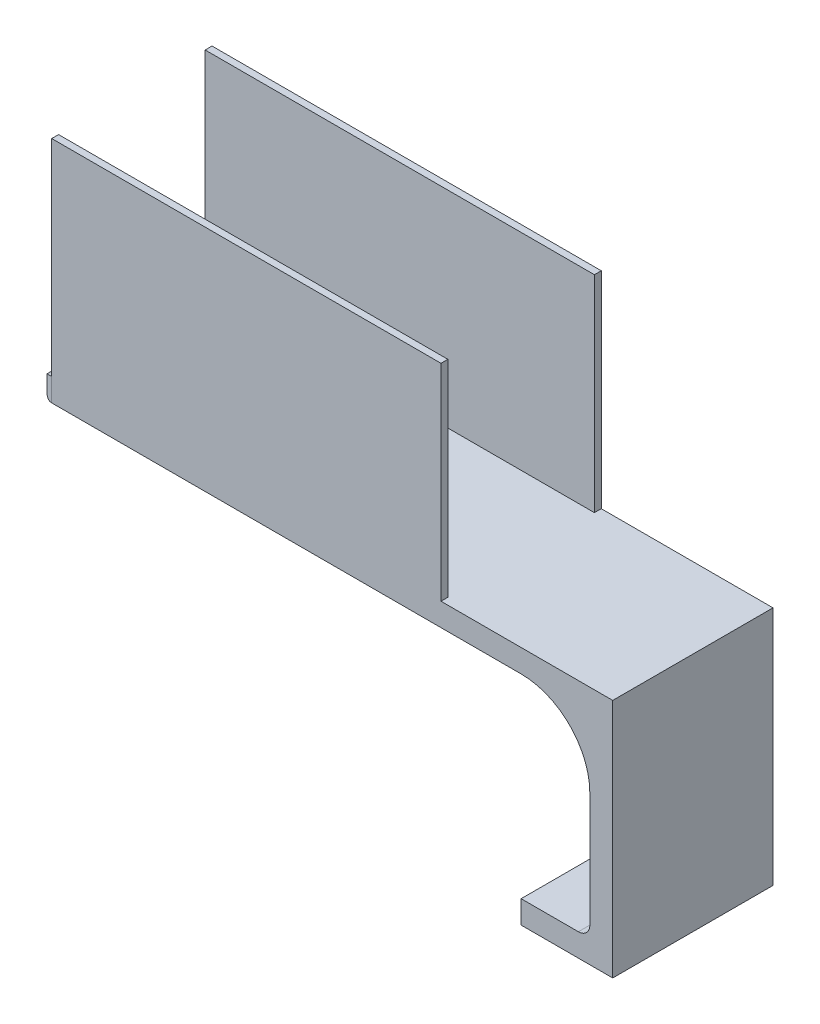
from build123d import *

# Parameters (mm, degrees)
BOSS_EXTRUDE1_DEPTH = 14
FILLET1_R           = 1
SKETCH2_W           = 0.834188385
SKETCH2_H           = 3
BOSS_EXTRUDE2_DEPTH = 0.8
SKETCH4_W           = 34
SKETCH4_H           = 0.6
BOSS_EXTRUDE3_DEPTH = 18
FILLET2_R           = 6


with BuildPart() as part:
    # Sketch1 → Boss-Extrude1 (new body)
    with BuildSketch(Plane.XY):
        Polygon((0, 0), (8, 0), (8, 21), (-42, 21), (-42, 19), (6, 19), (6, 2), (0, 2), align=None)
    extrude(amount=BOSS_EXTRUDE1_DEPTH)

    # Fillet1
    fillet1_edges = [part.edges().sort_by_distance(p)[0] for p in [
        (6, 2, 7),
        (-42, 19, 7),
        (-42, 21, 7),
        (-42, 20, 14),
        (-42, 20, 0),
    ]]
    fillet(fillet1_edges, radius=FILLET1_R - 0.0001)  # a hair under: the kernel refuses the full size

    # Sketch2 → Boss-Extrude2 (add)
    # profile 1 of 4: a face of its own
    with BuildSketch(Plane.ZY.offset(-6)):
        Polygon((4.939361172, 9.711644626), (4.939361172, 6.711644626), (4.105172787, 6.711644626), (4.105172787, 8.367093015), (3.539402215, 6.711644626), (2.841269648, 6.711644626), (2.271189615, 8.380021396), (2.271189615, 6.711644626), (1.43700123, 6.711644626), (1.43700123, 9.711644626), (2.445414938, 9.711644626), (3.198954852, 7.7625373), (3.934641287, 9.711644626), align=None)
    # profile 2 of 4: a face of its own
    with BuildSketch(Plane.ZY.offset(-6)):
        with Locations((5.833574182, 8.211644626)):
            Rectangle(SKETCH2_W, SKETCH2_H)
    # profile 3 of 4: a face of its own
    with BuildSketch(Plane.ZY.offset(-6)):
        with BuildLine():
            add(Edge.make_bspline(
                [(6.614509951, 8.218108816), (6.615135106, 8.254448488), (6.616373041, 8.326408498), (6.625189655, 8.432667458), (6.639209425, 8.536107559), (6.65939093, 8.636515812), (6.686243594, 8.733758084), (6.717322014, 8.828389932), (6.754995658, 8.919737366), (6.798850566, 9.007520954), (6.847178581, 9.091868165), (6.900855585, 9.171515602), (6.959668219, 9.246253038), (7.022837086, 9.316374569), (7.091146849, 9.381636211), (7.164565924, 9.44160163), (7.241976851, 9.498129553), (7.324872646, 9.548317457), (7.411265804, 9.593927372), (7.501416301, 9.633324168), (7.594752677, 9.66684746), (7.691397658, 9.693440882), (7.790923553, 9.715666032), (7.893905489, 9.729729553), (7.999914274, 9.739548614), (8.071699663, 9.740641742), (8.108045761, 9.741195211)],
                knots=[0, 0, 0, 0, 1.090921121, 2.160247797, 3.198836581, 4.223443441, 5.232277131, 6.225889638, 7.212121003, 8.195751059, 9.170075774, 10.128690879, 11.076474727, 12.023036313, 12.959924458, 13.90968863, 14.86725387, 15.835129268, 16.816189809, 17.798313747, 18.786313932, 19.790849238, 20.805928127, 21.845375407, 22.909078879, 24, 24, 24, 24], degree=3))
            add(Edge.make_bspline(
                [(8.108045761, 9.741195211), (8.154046355, 9.740184442), (8.244197417, 9.738203559), (8.376777061, 9.724541603), (8.503730488, 9.701545416), (8.624943818, 9.667651172), (8.741125222, 9.626398506), (8.851138025, 9.574118341), (8.955656013, 9.513049603), (9.05395443, 9.442773482), (9.145612872, 9.365118732), (9.228508, 9.279431694), (9.303260403, 9.187344206), (9.37012033, 9.088754614), (9.427487701, 8.982814897), (9.47594731, 8.870173202), (9.517232427, 8.751158904), (9.53683413, 8.668340065), (9.546789861, 8.626276269)],
                knots=[0, 0, 0, 0, 1.113135575, 2.18150124, 3.221796349, 4.231436138, 5.224276571, 6.201745712, 7.174434406, 8.150085186, 9.122368106, 10.077633641, 11.030857373, 11.989524825, 12.956211094, 13.941533538, 14.954502201, 16, 16, 16, 16], degree=3))
            Line((9.546789861, 8.626276269), (8.648575209, 8.626276269))
            add(Edge.make_bspline(
                [(8.648575209, 8.626276269), (8.63449873, 8.653367332), (8.607009, 8.70627303), (8.554750734, 8.777220049), (8.494294025, 8.83772523), (8.426434183, 8.887816356), (8.351706394, 8.926709067), (8.271496202, 8.95555173), (8.185279709, 8.972256045), (8.12597045, 8.974300325), (8.095733017, 8.975342553)],
                knots=[0, 0, 0, 0, 1.056424033, 2.063073462, 3.038256493, 4.009362991, 4.972841785, 5.946442968, 6.953042193, 8, 8, 8, 8], degree=3))
            add(Edge.make_bspline(
                [(8.095733017, 8.975342553), (8.072090982, 8.974857598), (8.026024844, 8.97391267), (7.958855252, 8.963438039), (7.895261592, 8.947998962), (7.835572703, 8.924638392), (7.779314442, 8.895753525), (7.726494212, 8.860395837), (7.677529764, 8.81819401), (7.633115793, 8.769428074), (7.591926635, 8.716234798), (7.558150732, 8.656990307), (7.527166037, 8.594975235), (7.503597705, 8.527604122), (7.484151008, 8.456511723), (7.471975244, 8.380528821), (7.462567968, 8.300837982), (7.461944601, 8.246048478), (7.461626717, 8.218108816)],
                knots=[0, 0, 0, 0, 1.019109895, 1.985719724, 2.926230684, 3.837105113, 4.743882796, 5.649968679, 6.572811938, 7.525125039, 8.491937575, 9.468270023, 10.462147427, 11.478754545, 12.541796802, 13.637803784, 14.795408623, 16, 16, 16, 16], degree=3))
            add(Edge.make_bspline(
                [(7.461626717, 8.218108816), (7.461932197, 8.189757505), (7.462529191, 8.1343511), (7.472061881, 8.053655274), (7.483974306, 7.977004795), (7.50371514, 7.905366671), (7.527170681, 7.837570259), (7.557994097, 7.77504496), (7.59194367, 7.715682222), (7.633111318, 7.662477774), (7.677530915, 7.61371476), (7.726493913, 7.571512181), (7.779314521, 7.536154688), (7.835572682, 7.507269769), (7.895261598, 7.483909213), (7.95885525, 7.468470132), (8.026024845, 7.457995502), (8.072090982, 7.457050574), (8.095733017, 7.456565619)],
                knots=[0, 0, 0, 0, 1.217704484, 2.379735683, 3.489019084, 4.548072599, 5.569165517, 6.567256767, 7.539925826, 8.503110694, 9.45185053, 10.371231102, 11.273917174, 12.177292452, 13.084749103, 14.021731083, 14.984714004, 16, 16, 16, 16], degree=3))
            add(Edge.make_bspline(
                [(8.095733017, 7.456565619), (8.125970495, 7.457607814), (8.185279842, 7.459652029), (8.271495701, 7.47635681), (8.351708196, 7.505197779), (8.426427502, 7.544096733), (8.494319234, 7.594164388), (8.554538191, 7.65464137), (8.607198031, 7.725083108), (8.634537031, 7.777897067), (8.648575209, 7.805016265)],
                knots=[0, 0, 0, 0, 1.047706149, 2.055024869, 3.02932196, 3.993489428, 4.965290051, 5.941170122, 6.942820858, 8, 8, 8, 8], degree=3))
            Line((8.648575209, 7.805016265), (9.546789861, 7.805016265))
            add(Edge.make_bspline(
                [(9.546789861, 7.805016265), (9.536858558, 7.762944138), (9.517349574, 7.680297939), (9.475808754, 7.561577975), (9.427505884, 7.449085635), (9.370107773, 7.343163076), (9.303292421, 7.244533723), (9.228299705, 7.152473009), (9.145837053, 7.066161648), (9.05392426, 6.988548174), (8.95566408, 6.918235146), (8.851135856, 6.857176288), (8.741125814, 6.804893457), (8.624943656, 6.76364152), (8.503730533, 6.729747075), (8.376777049, 6.706750944), (8.244197421, 6.693088973), (8.154046357, 6.691108091), (8.108045761, 6.690097324)],
                knots=[0, 0, 0, 0, 1.045571553, 2.053913598, 3.03930555, 4.006060013, 4.964795093, 5.918086069, 6.876988367, 7.849339876, 8.825059482, 9.797816793, 10.775354888, 11.76826536, 12.777976374, 13.818344869, 14.886785901, 16, 16, 16, 16], degree=3))
            add(Edge.make_bspline(
                [(8.108045761, 6.690097324), (8.071699626, 6.690650706), (7.999914166, 6.691743663), (7.893905905, 6.701563975), (7.790922048, 6.715622905), (7.691403112, 6.737864687), (7.594732679, 6.764397286), (7.501566436, 6.798115207), (7.411144585, 6.836651007), (7.324671539, 6.882258127), (7.242359489, 6.933327019), (7.164371021, 6.988993648), (7.090960402, 7.049064526), (7.023038193, 7.114919345), (6.959641238, 7.185011465), (6.900857249, 7.259781776), (6.847199661, 7.339433565), (6.798670926, 7.423888516), (6.755171797, 7.51205103), (6.7171746, 7.603669167), (6.686256305, 7.698778694), (6.659482893, 7.796440293), (6.63907019, 7.897421714), (6.625255023, 8.001509578), (6.616343023, 8.108781473), (6.615126146, 8.181358007), (6.614509951, 8.218108816)],
                knots=[0, 0, 0, 0, 1.088679172, 2.15019663, 3.187507745, 4.200500548, 5.202971437, 6.188941185, 7.166594588, 8.145638954, 9.114748649, 10.066759289, 11.014571603, 11.953790118, 12.898406428, 13.844242488, 14.800887546, 15.773209929, 16.760329183, 17.744533747, 18.741938946, 19.754633173, 20.777134367, 21.825771658, 22.899029122, 24, 24, 24, 24], degree=3))
        make_face()
    # profile 4 of 4: a face of its own
    with BuildSketch(Plane.ZY.offset(-6)):
        with BuildLine():
            add(Edge.make_bspline(
                [(11.385698131, 6.682094041), (11.350995943, 6.682674034), (11.282083675, 6.683825796), (11.179700309, 6.693412364), (11.079513162, 6.708516905), (10.981508096, 6.730462683), (10.885446339, 6.757730972), (10.791805014, 6.792809297), (10.699855187, 6.832514921), (10.610734436, 6.878847944), (10.524835579, 6.930203143), (10.443273911, 6.986870679), (10.366944363, 7.049047687), (10.293731103, 7.114577606), (10.226287319, 7.186220598), (10.163361039, 7.26224072), (10.104416959, 7.342609083), (10.050654037, 7.427825762), (10.001855232, 7.516851414), (9.96004412, 7.609316692), (9.924837224, 7.704620731), (9.89592124, 7.802738167), (9.872982895, 7.903665242), (9.857278801, 8.007584869), (9.846929643, 8.114060638), (9.845895752, 8.186071057), (9.845373896, 8.222418276)],
                knots=[0, 0, 0, 0, 1.027457631, 2.040345022, 3.042474354, 4.025911674, 5.012573142, 5.996967561, 6.984844717, 7.976899908, 8.969066769, 9.94683625, 10.914888525, 11.882883577, 12.854363136, 13.825405439, 14.8038734, 15.80362301, 16.807078105, 17.807916817, 18.805817775, 19.813386312, 20.835058856, 21.868144077, 22.923946896, 24, 24, 24, 24], degree=3))
            add(Edge.make_bspline(
                [(9.845373896, 8.222418276), (9.845895794, 8.258765477), (9.846929769, 8.330775857), (9.857278311, 8.437251906), (9.872984681, 8.541170502), (9.895914687, 8.642101352), (9.92486122, 8.74020496), (9.959890792, 8.835384579), (10.002025802, 8.92749718), (10.050634732, 9.016402607), (10.104413447, 9.101618216), (10.163392991, 9.181948302), (10.22606925, 9.258006029), (10.293983258, 9.32898211), (10.366700726, 9.394650773), (10.443524141, 9.456002268), (10.524613709, 9.512941083), (10.610951714, 9.563362952), (10.699691546, 9.610002481), (10.79182895, 9.648965715), (10.885575157, 9.683229086), (10.981405795, 9.71092277), (11.079607724, 9.731787774), (11.179686369, 9.747177007), (11.282087234, 9.756685395), (11.350997135, 9.757847733), (11.385698131, 9.758433052)],
                knots=[0, 0, 0, 0, 1.077069277, 2.133869147, 3.167929965, 4.190567328, 5.199087364, 6.197930693, 7.194177692, 8.198580403, 9.199274129, 10.178666109, 11.150625418, 12.118617686, 13.087526866, 14.052686502, 15.031379342, 16.02136737, 17.014359411, 18.000753053, 18.983990828, 19.971584052, 20.954652477, 21.957728173, 22.971572087, 24, 24, 24, 24], degree=3))
            add(Edge.make_bspline(
                [(11.385698131, 9.758433052), (11.420809199, 9.757851183), (11.490333357, 9.756699012), (11.593559687, 9.74719891), (11.694426951, 9.731675323), (11.793139794, 9.711214896), (11.889066891, 9.683090775), (11.982640495, 9.648965657), (12.07465287, 9.610144923), (12.162900615, 9.563335797), (12.24866793, 9.512970758), (12.329153966, 9.455790097), (12.405903293, 9.394857511), (12.478016985, 9.328942863), (12.545343487, 9.258000552), (12.607393056, 9.18193355), (12.66575914, 9.101601949), (12.718912194, 9.016383163), (12.766957247, 8.927496157), (12.808322445, 8.83524344), (12.843441304, 8.740210108), (12.872591964, 8.642186587), (12.894510846, 8.541079481), (12.910482751, 8.437264783), (12.920757551, 8.330772536), (12.921801574, 8.258764363), (12.922328544, 8.222418276)],
                knots=[0, 0, 0, 0, 1.041084035, 2.061472223, 3.071041691, 4.066480792, 5.048698968, 6.032405368, 7.019269139, 8.007333064, 8.992563031, 9.966735921, 10.932355565, 11.897227032, 12.861484175, 13.830033399, 14.806313925, 15.804242603, 16.806226752, 17.800437353, 18.799756744, 19.808757456, 20.830560156, 21.865113821, 22.922417377, 24, 24, 24, 24], degree=3))
            add(Edge.make_bspline(
                [(12.922328544, 8.222418276), (12.921801615, 8.186072172), (12.920757675, 8.114063962), (12.91048227, 8.007571983), (12.894512599, 7.903756296), (12.872585536, 7.802652811), (12.843464874, 7.704616011), (12.808170408, 7.609455891), (12.767123517, 7.51685661), (12.718903645, 7.427836136), (12.665716927, 7.342657834), (12.607488708, 7.262031818), (12.544435547, 7.186462746), (12.477689804, 7.114362527), (12.404416989, 7.0490805), (12.328132414, 6.986860392), (12.246555622, 6.930211278), (12.160671953, 6.878825556), (12.071672788, 6.83268263), (11.980068942, 6.792654014), (11.88655261, 6.757767731), (11.790324353, 6.730350255), (11.692262878, 6.708674083), (11.592118593, 6.693340944), (11.48972141, 6.683819628), (11.420604976, 6.682673092), (11.385698131, 6.682094041)],
                knots=[0, 0, 0, 0, 1.076827258, 2.133389664, 3.167218127, 4.188304562, 5.196597983, 6.19521687, 7.194280065, 8.195561842, 9.192790992, 10.168387163, 11.140128072, 12.108132088, 13.076823553, 14.045572283, 15.024045209, 16.016925874, 17.009694788, 17.992711629, 18.977814259, 19.96518557, 20.955268699, 21.952108375, 22.965724476, 24, 24, 24, 24], degree=3))
        make_face()
        with BuildLine():
            add(Edge.make_bspline(
                [(11.385698131, 7.456565619), (11.411585007, 7.457096176), (11.462324673, 7.458136097), (11.536206614, 7.468033666), (11.605835616, 7.484860668), (11.67128956, 7.507567963), (11.732833872, 7.536510362), (11.789898163, 7.572722733), (11.842952094, 7.61507825), (11.890950051, 7.664285102), (11.934838848, 7.718107458), (11.972247564, 7.777408124), (12.003840556, 7.841068523), (12.030449617, 7.908714182), (12.050736829, 7.981124337), (12.064598171, 8.057819871), (12.073428374, 8.138691769), (12.074608064, 8.194075368), (12.075211778, 8.222418276)],
                knots=[0, 0, 0, 0, 1.067089171, 2.09155204, 3.066481157, 4.016560595, 4.943945447, 5.864276661, 6.797319754, 7.73678768, 8.693626662, 9.656136735, 10.621173085, 11.620620688, 12.649338655, 13.716562035, 14.831436133, 16, 16, 16, 16], degree=3))
            add(Edge.make_bspline(
                [(12.075211778, 8.222418276), (12.074605033, 8.251375833), (12.073418892, 8.307985747), (12.064641874, 8.390504101), (12.050785352, 8.468428757), (12.030595052, 8.541509171), (12.003636315, 8.609410128), (11.972614783, 8.673382164), (11.934618508, 8.73234221), (11.890949936, 8.786071629), (11.843147813, 8.835346483), (11.78968563, 8.876972687), (11.732865043, 8.913300654), (11.671269185, 8.942130353), (11.605931614, 8.965095728), (11.536106236, 8.980894732), (11.46233898, 8.991069868), (11.41158984, 8.99207009), (11.385698131, 8.992580394)],
                knots=[0, 0, 0, 0, 1.18883488, 2.324085585, 3.403324648, 4.435760984, 5.430939693, 6.399398042, 7.350695849, 8.303447928, 9.238903148, 10.162711262, 11.079111508, 12.002535262, 12.948556669, 13.917381511, 14.937468638, 16, 16, 16, 16], degree=3))
            add(Edge.make_bspline(
                [(11.385698131, 8.992580394), (11.359392659, 8.99209695), (11.308226521, 8.991156615), (11.233687246, 8.980726107), (11.163363998, 8.965307445), (11.097662036, 8.942118339), (11.036093397, 8.913274082), (10.979287837, 8.87717668), (10.926397903, 8.835103282), (10.878573504, 8.786275101), (10.835513671, 8.732312824), (10.798275602, 8.673196755), (10.767003005, 8.609556154), (10.740811649, 8.541460389), (10.72137548, 8.468338615), (10.707324505, 8.390514569), (10.698605267, 8.307982927), (10.697411015, 8.251374879), (10.696800122, 8.222418276)],
                knots=[0, 0, 0, 0, 1.078588718, 2.097936879, 3.082471155, 4.02780725, 4.950562063, 5.866298455, 6.782847408, 7.71762497, 8.664422376, 9.610508143, 10.578264927, 11.569688157, 12.59914077, 13.677598016, 14.812026329, 16, 16, 16, 16], degree=3))
            add(Edge.make_bspline(
                [(10.696800122, 8.222418276), (10.697400714, 8.193665585), (10.698570392, 8.137668533), (10.707381622, 8.055968006), (10.721350475, 7.978946988), (10.740927848, 7.906282926), (10.766983419, 7.838348802), (10.798309451, 7.774743053), (10.835314684, 7.715649369), (10.878783161, 7.662211949), (10.926398856, 7.613450591), (10.979106269, 7.571261936), (11.0362902, 7.535983946), (11.097634928, 7.506983947), (11.163371662, 7.483850932), (11.233685089, 7.468416427), (11.308227105, 7.457990341), (11.359392858, 7.457049383), (11.385698131, 7.456565619)],
                knots=[0, 0, 0, 0, 1.183449987, 2.30481765, 3.378522997, 4.403220538, 5.397914201, 6.368863349, 7.318069994, 8.261394005, 9.199255143, 10.118827539, 11.033107389, 11.958906117, 12.907360617, 13.895142602, 14.917853314, 16, 16, 16, 16], degree=3))
        make_face(mode=Mode.SUBTRACT)
    extrude(amount=BOSS_EXTRUDE2_DEPTH)

    # Sketch4 → Boss-Extrude3 (add)
    with BuildSketch(Plane(origin=(0, 21, 0), x_dir=(1, 0, 0), z_dir=(0, 1, 0))):
        with Locations((-24, -0.3)):
            Rectangle(SKETCH4_W, SKETCH4_H)
        with Locations((-24, -13.7)):
            Rectangle(SKETCH4_W, SKETCH4_H)
    extrude(amount=BOSS_EXTRUDE3_DEPTH)

    # Fillet2
    fillet2_edges = [part.edges().sort_by_distance(p)[0] for p in [
        (6, 19, 7),
    ]]
    fillet(fillet2_edges, radius=FILLET2_R)


solid = part.part
